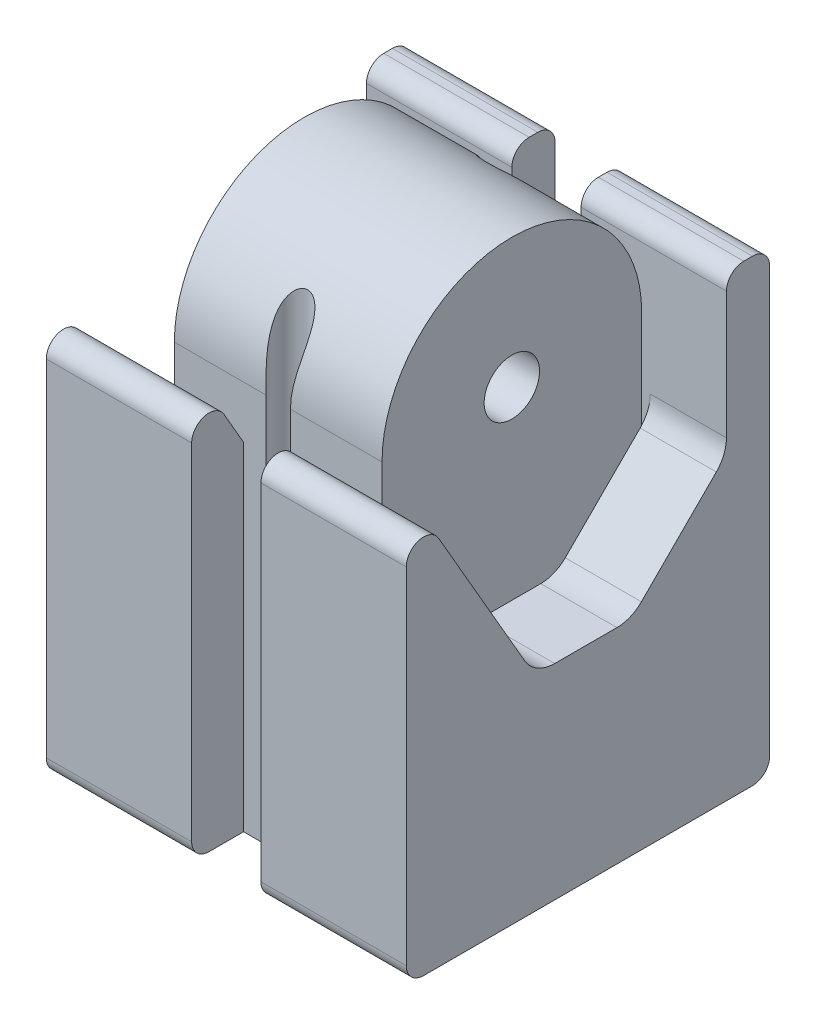
from build123d import *

# Parameters (mm, degrees)
SKETCH1_R                    = 1.6
BASE_DEPTH                   = 6
PTFE_CLAMP_3MM_OD_DEPTH      = 32.5
PTFE_CLAMP_1_6MM_OD_DEPTH    = 32.500000138
SKETCH3_R                    = 2.9
RUTHEX_M3_INSERT_HOLE_DEPTH  = 8.3
SIDE_PROFILE_DEPTH           = 4.4
ANGLE_CONSTRAINT_BACK_START  = -4
ANGLE_CONSTRAINT_BACK_DEPTH  = 8.4
ANGLE_CONSTRAINT_FRONT_START = -4
ANGLE_CONSTRAINT_FRONT_DEPTH = 8.4
FILLET4_R                    = 1
FILLET5_R                    = 2
FILLET4_OF_MIRROR4_R         = 1
FILLET5_OF_MIRROR4_R         = 2


with BuildPart() as part:
    # Sketch1 → base (new, symmetric)
    with BuildSketch(Plane(origin=(0, 0, 0), x_dir=(0, 0, -1), z_dir=(1, 0, 0))):
        with BuildLine():
            Line((7.5, 0), (-7.5, 0))
            Line((-7.5, 0), (-7.5, 22.5))
            ThreePointArc((-7.5, 22.5), (0, 30), (7.5, 22.5))
            Line((7.5, 22.5), (7.5, 0))
        make_face()
        with Locations((0, 22.5)):
            Circle(SKETCH1_R, mode=Mode.SUBTRACT)
    extrude(amount=BASE_DEPTH, both=True)

    # Sketch2 → PTFE_clamp_3mm_OD (cut, through all)
    with BuildSketch(Plane.XZ):
        with BuildLine():
            Line((0, -7.5), (1.202081528, -7.5))
            ThreePointArc((1.202081528, -7.5), (1.570595205, -5.647356637), (0, -4.597918472))
            Line((0, -4.597918472), (0, -7.5))
        make_face()
        with BuildLine():
            Line((-1.202081528, -7.5), (0, -7.5))
            Line((0, -7.5), (0, -4.597918472))
            ThreePointArc((0, -4.597918472), (-1.570595205, -5.647356637), (-1.202081528, -7.5))
        make_face()
        with BuildLine():
            Line((0, -7.5), (1.202081528, -7.5))
            ThreePointArc((1.202081528, -7.5), (1.570595205, -5.647356637), (0, -4.597918472))
            Line((0, -4.597918472), (0, -7.5))
        make_face()
        with BuildLine():
            Line((-1.202081528, -7.5), (0, -7.5))
            Line((0, -7.5), (0, -4.597918472))
            ThreePointArc((0, -4.597918472), (-1.570595205, -5.647356637), (-1.202081528, -7.5))
        make_face()
    extrude(amount=-PTFE_CLAMP_3MM_OD_DEPTH, mode=Mode.SUBTRACT)

    # Sketch2<3> → PTFE_clamp_1.6mm_OD (cut, through all)
    with BuildSketch(Plane.XZ):
        with BuildLine():
            ThreePointArc((-0.707106781, 7.5), (-0.923879533, 6.410209786), (0, 5.792893219))
            Line((0, 5.792893219), (0, 7.5))
            Line((0, 7.5), (-0.707106781, 7.5))
        make_face()
        with BuildLine():
            Line((0, 7.5), (0, 5.792893219))
            ThreePointArc((0, 5.792893219), (0.923879533, 6.410209786), (0.707106781, 7.5))
            Line((0.707106781, 7.5), (0, 7.5))
        make_face()
        with BuildLine():
            ThreePointArc((-0.707106781, 7.5), (-0.923879533, 6.410209786), (0, 5.792893219))
            Line((0, 5.792893219), (0, 7.5))
            Line((0, 7.5), (-0.707106781, 7.5))
        make_face()
        with BuildLine():
            Line((0, 7.5), (0, 5.792893219))
            ThreePointArc((0, 5.792893219), (0.923879533, 6.410209786), (0.707106781, 7.5))
            Line((0.707106781, 7.5), (0, 7.5))
        make_face()
    extrude(amount=-PTFE_CLAMP_1_6MM_OD_DEPTH, mode=Mode.SUBTRACT)

    # Sketch3 → ruthex_m3_insert_hole (cut)
    with BuildSketch(Plane.XZ):
        with Locations(Location((0, 0, 0), (0, 0, 270))):
            Circle(SKETCH3_R)
    extrude(amount=-RUTHEX_M3_INSERT_HOLE_DEPTH, mode=Mode.SUBTRACT)

    # Sketch4 → side_profile (add)
    with BuildSketch(Plane.ZY.offset(6)):
        Polygon((-8, 0), (7.5, 0), (7.5, 19.490381057), (3.077350269, 11.830127019), (-2.5, 11.830127019), (-8, 17.330127019), align=None)
    side_profile = extrude(amount=SIDE_PROFILE_DEPTH)

    # Sketch4<4> → angle_constraint_back (add)
    with BuildSketch(Plane.ZY.offset(6).offset(ANGLE_CONSTRAINT_BACK_START)):
        Polygon((-10.5, 0), (-8, 0), (-8, 17.330127019), (-8, 26.5), (-10.5, 26.5), align=None)
    angle_constraint_back = extrude(amount=ANGLE_CONSTRAINT_BACK_DEPTH)

    # Sketch4<6> → angle_constraint_front (add)
    with BuildSketch(Plane.ZY.offset(6).offset(ANGLE_CONSTRAINT_FRONT_START)):
        Polygon((7.5, 19.490381057), (7.5, 0), (10.5, 0), (10.5, 24.686533479), align=None)
    angle_constraint_front = extrude(amount=ANGLE_CONSTRAINT_FRONT_DEPTH)

    # Fillet4
    fillet4_edges = [part.edges().sort_by_distance(p)[0] for p in [
        (-6.2, 26.5, -8),
        (-6.2, 0, -10.5),
        (-6.2, 26.5, -10.5),
        (-6.2, 24.686533479, 10.5),
        (-6.2, 0, 10.5),
    ]]
    fillet(fillet4_edges, radius=FILLET4_R)

    # Fillet5
    # the kernel refuses this fillet: 2 mm, written as the material it adds along each edge
    with BuildSketch(Plane(origin=(-3.113248654, 11.830127019, 3.077350269), x_dir=(0, 0.8660254037844377, 0.5000000000000013), z_dir=(-1, 0, 0))) as fillet5_piece_1:
        with BuildLine():
            CenterArc((FILLET5_R * 0.57735026919, FILLET5_R), FILLET5_R, 210, 60)
            Line((-FILLET5_R * 0.288675134595, FILLET5_R * 0.5), (0, 0))
            Line((0, 0), (FILLET5_R * 0.57735026919, 0))
        make_face()
    extrude(amount=7.286751346)
    with BuildSketch(Plane(origin=(-3.928932188, 11.830127019, -2.5), x_dir=(0, 0.7071067811865489, -0.7071067811865462), z_dir=(-1, 0, 0))) as fillet5_piece_2:
        with BuildLine():
            CenterArc((FILLET5_R * 0.414213562373, -FILLET5_R), FILLET5_R, 90, 45)
            Line((-FILLET5_R * 0.292893218813, -FILLET5_R * 0.292893218813), (0, 0))
            Line((0, 0), (FILLET5_R * 0.414213562373, 0))
        make_face()
    extrude(amount=6.471067812)
    with BuildSketch(Plane(origin=(-6, 17.330127019, -8), x_dir=(0, 1, 0), z_dir=(-1, 0, 0))) as fillet5_piece_3:
        with BuildLine():
            CenterArc((FILLET5_R * 0.414213562373, -FILLET5_R), FILLET5_R, 90, 45)
            Line((-FILLET5_R * 0.292893218813, -FILLET5_R * 0.292893218813), (0, 0))
            Line((0, 0), (FILLET5_R * 0.414213562373, 0))
        make_face()
    extrude(amount=4.4)

    # Mirror4: side_profile, angle_constraint_back, angle_constraint_front across plane
    add(side_profile.mirror(Plane(origin=(0, 0, 0), x_dir=(0, 0, 1), z_dir=(1, 0, 0))))
    add(angle_constraint_back.mirror(Plane(origin=(0, 0, 0), x_dir=(0, 0, 1), z_dir=(1, 0, 0))))
    add(angle_constraint_front.mirror(Plane(origin=(0, 0, 0), x_dir=(0, 0, 1), z_dir=(1, 0, 0))))

    # Fillet4 of Mirror4
    fillet4_of_mirror4_edges = [part.edges().sort_by_distance(p)[0] for p in [
        (6.2, 26.5, -8),
        (6.2, 0, -10.5),
        (6.2, 26.5, -10.5),
        (6.2, 24.686533479, 10.5),
        (6.2, 0, 10.5),
    ]]
    fillet(fillet4_of_mirror4_edges, radius=FILLET4_OF_MIRROR4_R)

    # Fillet5 of Mirror4
    # the kernel refuses this fillet: 2 mm, written as the material it adds along each edge
    with BuildSketch(Plane(origin=(3.113248654, 11.830127019, 3.077350269), x_dir=(0, 0.8660254037844386, 0.5000000000000002), z_dir=(1, 0, 0))) as fillet5_of_mirror4_piece_1:
        with BuildLine():
            CenterArc((FILLET5_OF_MIRROR4_R * 0.57735026919, -FILLET5_OF_MIRROR4_R), FILLET5_OF_MIRROR4_R, 90, 60)
            Line((-FILLET5_OF_MIRROR4_R * 0.288675134595, -FILLET5_OF_MIRROR4_R * 0.5), (0, 0))
            Line((0, 0), (FILLET5_OF_MIRROR4_R * 0.57735026919, 0))
        make_face()
    extrude(amount=7.286751346)
    with BuildSketch(Plane(origin=(3.928932188, 11.830127019, -2.5), x_dir=(0, 0, 1), z_dir=(1, 0, 0))) as fillet5_of_mirror4_piece_2:
        with BuildLine():
            CenterArc((FILLET5_OF_MIRROR4_R * 0.414213562373, -FILLET5_OF_MIRROR4_R), FILLET5_OF_MIRROR4_R, 90, 45)
            Line((-FILLET5_OF_MIRROR4_R * 0.292893218813, -FILLET5_OF_MIRROR4_R * 0.292893218813), (0, 0))
            Line((0, 0), (FILLET5_OF_MIRROR4_R * 0.414213562373, 0))
        make_face()
    extrude(amount=6.471067812)
    with BuildSketch(Plane(origin=(6, 17.330127019, -8), x_dir=(0, 1, 0), z_dir=(1, 0, 0))) as fillet5_of_mirror4_piece_3:
        with BuildLine():
            CenterArc((FILLET5_OF_MIRROR4_R * 0.414213562373, FILLET5_OF_MIRROR4_R), FILLET5_OF_MIRROR4_R, 225, 45)
            Line((-FILLET5_OF_MIRROR4_R * 0.292893218813, FILLET5_OF_MIRROR4_R * 0.292893218813), (0, 0))
            Line((0, 0), (FILLET5_OF_MIRROR4_R * 0.414213562373, 0))
        make_face()
    extrude(amount=4.4)


solid = part.part
